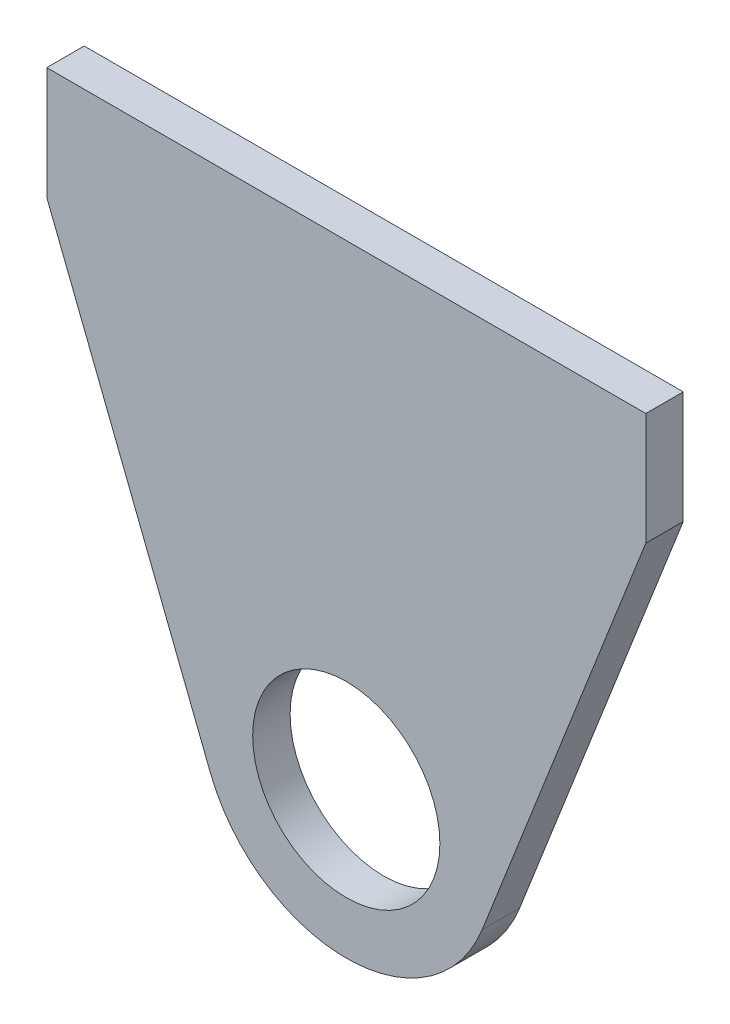
from build123d import *

# Parameters (mm, degrees)
SKETCH_2_R             = 12.5
SM_BASE_FLANGE_1_DEPTH = 5


# Sheet-metal steps are written as plain solids
with BuildPart() as part:
    # Sketch 2 → Базовая кромка1 (new body)
    with BuildSketch(Plane.XY):
        with BuildLine():
            Line((-18.150140865, -72.128982157), (-40, -16.5))
            Line((-40, -16.5), (-40, -1.5))
            Line((-40, -1.5), (40, -1.5))
            Line((40, -1.5), (40, -16.5))
            Line((40, -16.5), (18.150140865, -72.128982157))
            ThreePointArc((18.150140865, -72.128982157), (0, -84.5), (-18.150140865, -72.128982157))
        make_face()
        with Locations(Location((0, -65, 0), (0, 0, 180))):
            Circle(SKETCH_2_R, mode=Mode.SUBTRACT)
    extrude(amount=SM_BASE_FLANGE_1_DEPTH)


solid = part.part
